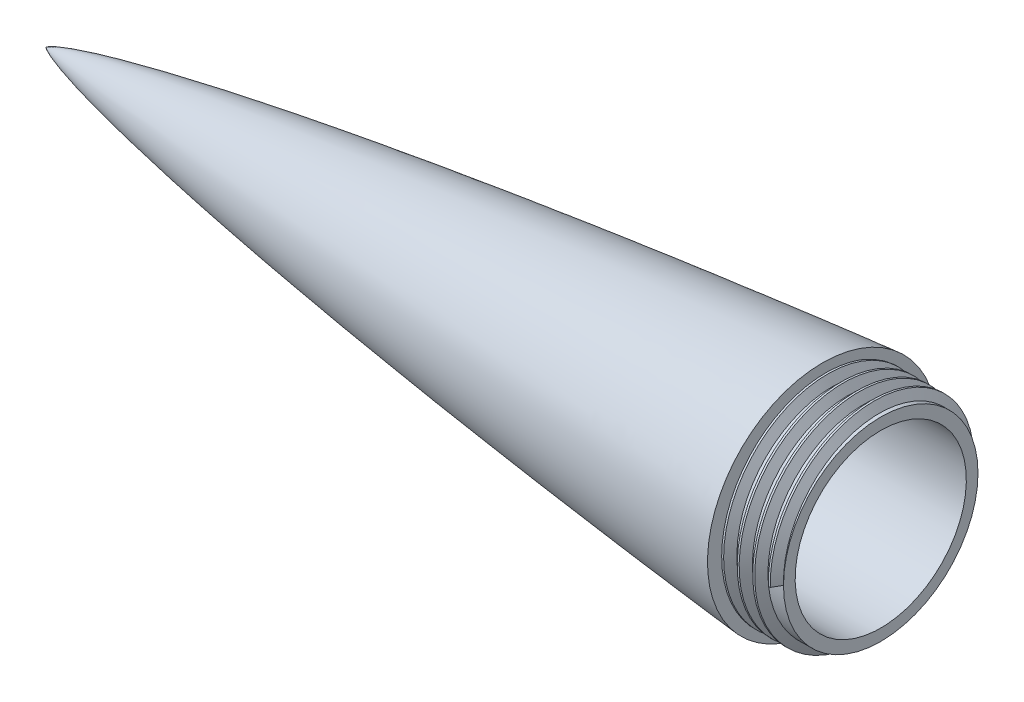
from build123d import *

# Parameters (mm, degrees)
SKETCH14_R                      = 25.050327999
SKETCH14_R_2                    = 22.050327999
BOSS_EXTRUDE1_DEPTH             = 15
BOSS_EXTRUDE1_DIRECTION_2_REACH = 206.342
THREAD2_PITCH                   = 4


with BuildPart() as part:
    # Sketch1 → Revolve1 (revolve)
    with BuildSketch(Plane.XY):
        with BuildLine():
            Line((-153.237304308, 33), (0, 33))
            Line((0, 33), (0, 38))
            Line((0, 38), (-60, 38))
            Line((-60, 38), (-60, 41.9))
            add(Edge.make_bspline(
                [(-460, 0), (-459.996067969, 0.009726018), (-459.985785217, 0.02780424), (-459.957005025, 0.058902426), (-459.91205001, 0.100212526), (-459.856244624, 0.143432876), (-459.775484012, 0.200311335), (-459.683468726, 0.258611779), (-459.579785862, 0.319460144), (-459.418939028, 0.407565244), (-459.180873374, 0.528192028), (-458.777616559, 0.714285403), (-458.057255833, 1.0123178), (-456.771507758, 1.483474784), (-454.40722191, 2.241844729), (-449.963807437, 3.474543289), (-442.199798746, 5.321162346), (-428.97101079, 8.026665147), (-410.788345474, 11.220424569), (-388.73281348, 14.634427911), (-364.190784603, 18.036918263), (-339.610222302, 21.14585558), (-315.00008174, 24.010782423), (-290.366278158, 26.663429751), (-265.712399697, 29.122407259), (-241.041086643, 31.39940616), (-216.354099064, 33.499758191), (-191.652773648, 35.424046474), (-170.027352253, 36.949507855), (-151.483266154, 38.137109734), (-136.024634606, 39.040436446), (-123.654619224, 39.707777336), (-111.281493824, 40.315125483), (-100.452283743, 40.78818035), (-91.168142985, 41.145909221), (-83.707200452, 41.397635934), (-78.07036158, 41.56649526), (-73.345484372, 41.688284291), (-69.532872299, 41.7726603), (-66.355463671, 41.830361619), (-63.813396377, 41.870139432), (-61.906740046, 41.888745562), (-60.635587942, 41.9), (-60, 41.9)],
                knots=[0, 0, 0, 0, 0, 0.000103786, 0.000207572, 0.000415145, 0.000608587, 0.000802029, 0.001188912, 0.00149546, 0.001802008, 0.002622229, 0.003837599, 0.005902992, 0.009538441, 0.016211619, 0.02847806, 0.051665811, 0.088742351, 0.150226851, 0.211711468, 0.273196132, 0.334680786, 0.396165341, 0.457649956, 0.519134579, 0.580619211, 0.642103793, 0.703588429, 0.765073013, 0.795815252, 0.826557492, 0.857299765, 0.888042038, 0.918784374, 0.934155543, 0.949526711, 0.962145033, 0.974763355, 0.981072517, 0.987381678, 0.993690839, 1, 1, 1, 1, 1], degree=4))
            Line((-460, 0), (-442.793127384, 0))
            ThreePointArc((-442.793127384, 0), (-298.586447591, 21.512226611), (-153.237304308, 33))
        make_face()
    revolve(axis=Axis((-442.793127384, 0, 0), (-1, 0, 0)))

    # SurfaceCut1
    split(bisect_by=Plane(origin=(-260, 0, 0), x_dir=(0, 0, -1), z_dir=(1, 0, 0)), keep=Keep.BOTTOM)

    # Sketch14 → Boss-Extrude1 (add)
    with BuildSketch(Plane(origin=(-260, 0, 0), x_dir=(0, 0, -1), z_dir=(1, 0, 0))):
        with Locations(Location((0, 0, 0), (0, 0, 90))):
            Circle(SKETCH14_R)
        with Locations(Location((0, 0, 0), (0, 0, 90))):
            Circle(SKETCH14_R_2, mode=Mode.SUBTRACT)
    extrude(amount=BOSS_EXTRUDE1_DEPTH)

    # Sketch14 → Boss-Extrude1 direction 2 (add, up to next)
    with BuildSketch(Plane(origin=(-260, 0, 0), x_dir=(0, 0, -1), z_dir=(1, 0, 0)), mode=Mode.PRIVATE) as boss_extrude1_direction_2_sk1:
        with Locations(Location((0, 0, 0), (0, 0, 90))):
            Circle(SKETCH14_R)
        with Locations(Location((0, 0, 0), (0, 0, 90))):
            Circle(SKETCH14_R_2, mode=Mode.SUBTRACT)
    boss_extrude1_direction_2_tool1 = extrude(boss_extrude1_direction_2_sk1.sketch, amount=-BOSS_EXTRUDE1_DIRECTION_2_REACH, mode=Mode.PRIVATE) - part.part
    add(boss_extrude1_direction_2_tool1.solids().sort_by_distance((-260, -24.341798, 0))[0])

    # Thread2: the profile of Thread Profile2 profile screwed along a right-hand helix of 8.75 turns, 12 arcs to a turn; built about Z, then put on its axis
    thread2_z = Axis((0, 0, 0), (0, 0, 1))
    thread2_corners = [(25.050027999, 0, -0.000173205), (27.215391499, 0, 1.249999995), (27.215391499, 0, 1.749999995), (25.050027999, 0, 3.000173194)]
    with BuildLine(mode=Mode.PRIVATE) as thread2_profile:
        Line(thread2_corners[0], thread2_corners[1])
        Line(thread2_corners[1], thread2_corners[2])
        Line(thread2_corners[2], thread2_corners[3])
        Line(thread2_corners[3], thread2_corners[0])
    thread2_cap = Face(thread2_profile.wire())
    thread2_turn_angles = [0, 15, 30, 45, 60, 75, 90, 105, 120, 135, 150, 165, 180, 195, 210, 225, 240, 255, 270, 285, 300, 315, 330, 345, 360]
    thread2_turn_weights = [1, 0.9659258262890683, 1, 0.9659258262890683, 1, 0.9659258262890683, 1, 0.9659258262890683, 1, 0.9659258262890683, 1, 0.9659258262890683, 1, 0.9659258262890683, 1, 0.9659258262890683, 1, 0.9659258262890683, 1, 0.9659258262890683, 1, 0.9659258262890683, 1, 0.9659258262890683, 1]
    thread2_turn_rails = [Edge.make_bspline([Vector(p[0], p[1], 0).rotate(thread2_z, thread2_turn_angles[k]) / thread2_turn_weights[k] + Vector(0, 0, p[2] + THREAD2_PITCH * thread2_turn_angles[k] / 360) for k in range(25)], [0, 0, 0, 1, 1, 2, 2, 3, 3, 4, 4, 5, 5, 6, 6, 7, 7, 8, 8, 9, 9, 10, 10, 11, 11, 12, 12, 12], 2, thread2_turn_weights) for p in thread2_corners]
    thread2_turn_sides = [Face.make_surface_from_curves(thread2_turn_rails[p[0]], thread2_turn_rails[p[1]]) for p in [(0, 1), (1, 2), (2, 3), (3, 0)]]
    thread2_last_angles = [2880, 2895, 2910, 2925, 2940, 2955, 2970, 2985, 3000, 3015, 3030, 3045, 3060, 3075, 3090, 3105, 3120, 3135, 3150]
    thread2_last_weights = [1, 0.9659258262890683, 1, 0.9659258262890683, 1, 0.9659258262890683, 1, 0.9659258262890683, 1, 0.9659258262890683, 1, 0.9659258262890683, 1, 0.9659258262890683, 1, 0.9659258262890683, 1, 0.9659258262890683, 1]
    thread2_last_rails = [Edge.make_bspline([Vector(p[0], p[1], 0).rotate(thread2_z, thread2_last_angles[k]) / thread2_last_weights[k] + Vector(0, 0, p[2] + THREAD2_PITCH * thread2_last_angles[k] / 360) for k in range(19)], [0, 0, 0, 1, 1, 2, 2, 3, 3, 4, 4, 5, 5, 6, 6, 7, 7, 8, 8, 9, 9, 9], 2, thread2_last_weights) for p in thread2_corners]
    thread2_last_sides = [Face.make_surface_from_curves(thread2_last_rails[p[0]], thread2_last_rails[p[1]]) for p in [(0, 1), (1, 2), (2, 3), (3, 0)]]
    thread2 = Plane(origin=(-245, 0, 0), x_dir=(0, 0, 1), z_dir=(-1, 0, 0)) * Solid(Shell([*[p.moved(Location((0, 0, THREAD2_PITCH * i))) for i in range(8) for p in thread2_turn_sides], *thread2_last_sides, thread2_cap, thread2_cap.rotate(thread2_z, 3150).moved(Location((0, 0, THREAD2_PITCH * 3150 / 360)))]))
    add(thread2)


solid = part.part
